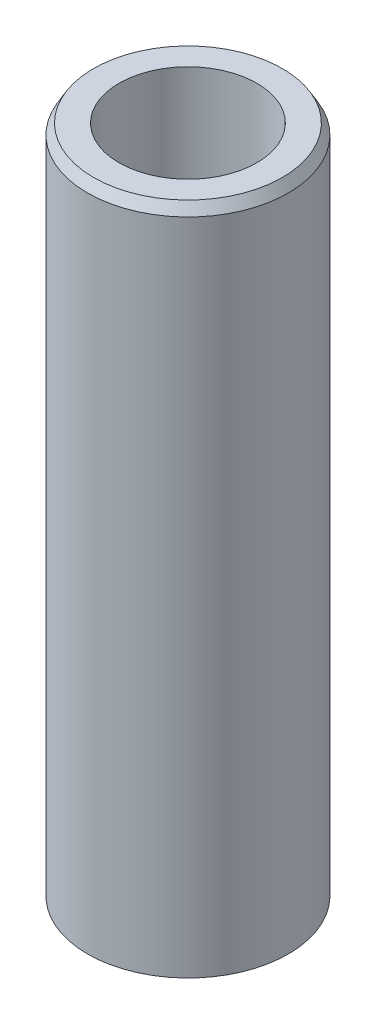
from build123d import *
from OCP.BRepFilletAPI import BRepFilletAPI_MakeChamfer

# Parameters (mm, degrees)
SKETCH1_R           = 55
BOSS_EXTRUDE1_DEPTH = 370.017684343
SKETCH2_R           = 37.747867969
CUT_EXTRUDE1_DEPTH  = 379.1045976
CHAMFER1_SIZE       = 5.708057742
CHAMFER1_SIZE2      = 3.295548674


with BuildPart() as part:
    # Sketch1 → Boss-Extrude1 (new body)
    with BuildSketch(Plane(origin=(0, 0, 0), x_dir=(1, 0, 0), z_dir=(0, 1, 0))):
        Circle(SKETCH1_R)
    extrude(amount=BOSS_EXTRUDE1_DEPTH)

    # Sketch2 → Cut-Extrude1 (cut, through all)
    with BuildSketch(Plane(origin=(0, 0, 0), x_dir=(1, 0, 0), z_dir=(0, 1, 0))):
        Circle(SKETCH2_R)
    extrude(amount=CUT_EXTRUDE1_DEPTH, mode=Mode.SUBTRACT)

    # Chamfer1: one chamfer whose edges measure the first distance from different faces: ONE call of the kernel's chamfer builder (chamfer() names one face for all edges)
    chamfer1_edges_1 = [part.edges().sort_by_distance(p)[0] for p in [
        (-55, 370.017684343, 0),
    ]]
    chamfer1_side_1 = [part.faces().sort_by_distance(p)[0] for p in [
        (-55, 185.008842171, 0),
    ]]
    chamfer1_edges_2 = [part.edges().sort_by_distance(p)[0] for p in [
        (-55, 0, 0),
    ]]
    chamfer1_side_2 = [part.faces().sort_by_distance(p)[0] for p in [
        (-53.444365081, 0, 0),
    ]]
    chamfer1 = BRepFilletAPI_MakeChamfer(part.part.solid().wrapped)
    for e in chamfer1_edges_1:
        chamfer1.Add(CHAMFER1_SIZE, CHAMFER1_SIZE2, e.wrapped, chamfer1_side_1[0].wrapped)  # the first distance lies on this face
    for e in chamfer1_edges_2:
        chamfer1.Add(CHAMFER1_SIZE, CHAMFER1_SIZE2, e.wrapped, chamfer1_side_2[0].wrapped)  # the first distance lies on this face
    add(Compound.cast(chamfer1.Shape()), mode=Mode.REPLACE)


solid = part.part
